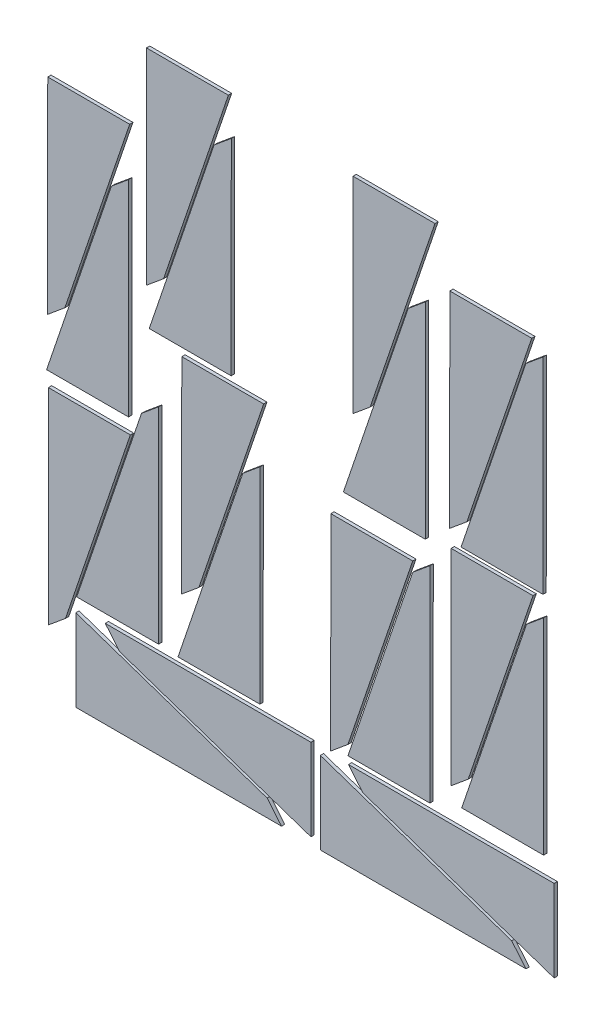
from build123d import *

# Parameters (mm, degrees)
BOSS_EXTRUDE1_DEPTH    = 0.5
BOSS_EXTRUDE1_2_DEPTH  = 0.5
BOSS_EXTRUDE1_3_DEPTH  = 0.5
BOSS_EXTRUDE1_4_DEPTH  = 0.5
BOSS_EXTRUDE1_5_DEPTH  = 0.5
BOSS_EXTRUDE1_6_DEPTH  = 0.5
BOSS_EXTRUDE1_7_DEPTH  = 0.5
BOSS_EXTRUDE1_8_DEPTH  = 0.5
BOSS_EXTRUDE1_9_DEPTH  = 0.5
BOSS_EXTRUDE1_10_DEPTH = 0.5
BOSS_EXTRUDE1_11_DEPTH = 0.5
BOSS_EXTRUDE1_12_DEPTH = 0.5
BOSS_EXTRUDE1_13_DEPTH = 0.5
BOSS_EXTRUDE1_14_DEPTH = 0.5
BOSS_EXTRUDE1_15_DEPTH = 0.5
BOSS_EXTRUDE1_16_DEPTH = 0.5
BOSS_EXTRUDE1_17_DEPTH = 0.5
BOSS_EXTRUDE1_18_DEPTH = 0.5
BOSS_EXTRUDE1_19_DEPTH = 0.5
BOSS_EXTRUDE1_20_DEPTH = 0.5


with BuildPart() as part:
    # Model → Boss-Extrude1 (new body)
    with BuildSketch(Plane.XY):
        Polygon((18.0727, 97.8343), (18.0727, 97.8187), (18.072691244, 97.803735595), (18.0543, 66.371), (20.664165109, 68.54157794), (20.6886, 68.5619), (20.698783041, 68.591962529), (30.6039, 97.834), (18.100296093, 97.83429954), (18.0811, 97.8343), align=None)
    extrude(amount=BOSS_EXTRUDE1_DEPTH)


with BuildPart() as body_2:
    # Model → Boss-Extrude1 2 (new body)
    with BuildSketch(Plane.XY):
        Polygon((31.0273, 60.8657), (31.0273, 60.8813), (31.027308756, 60.896264405), (31.0457, 92.329), (28.435834891, 90.15842206), (28.4114, 90.1381), (28.401216959, 90.108037471), (18.4961, 60.866), (30.999703907, 60.86570046), (31.0189, 60.8657), align=None)
    extrude(amount=BOSS_EXTRUDE1_2_DEPTH)


with BuildPart() as body_3:
    # Model → Boss-Extrude1 3 (new body)
    with BuildSketch(Plane.XY):
        Polygon((2.9727, 86.4343), (2.9727, 86.4187), (2.972691244, 86.403735595), (2.9543, 54.971), (5.564165109, 57.14157794), (5.5886, 57.1619), (5.598783041, 57.191962529), (15.5039, 86.434), (3.000296093, 86.43429954), (2.9811, 86.4343), align=None)
    extrude(amount=BOSS_EXTRUDE1_3_DEPTH)


with BuildPart() as body_4:
    # Model → Boss-Extrude1 4 (new body)
    with BuildSketch(Plane.XY):
        Polygon((15.3273, 47.5657), (15.3273, 47.5813), (15.327308756, 47.596264405), (15.3457, 79.029), (12.735834891, 76.85842206), (12.7114, 76.8381), (12.701216959, 76.808037471), (2.7961, 47.566), (15.299703907, 47.56570046), (15.3189, 47.5657), align=None)
    extrude(amount=BOSS_EXTRUDE1_4_DEPTH)


with BuildPart() as body_5:
    # Model → Boss-Extrude1 5 (new body)
    with BuildSketch(Plane.XY):
        Polygon((23.4727, 59.6343), (23.4727, 59.6187), (23.472691244, 59.603735595), (23.4543, 28.171), (26.064165109, 30.34157794), (26.0886, 30.3619), (26.098783041, 30.391962529), (36.0039, 59.634), (23.500296093, 59.63429954), (23.4811, 59.6343), align=None)
    extrude(amount=BOSS_EXTRUDE1_5_DEPTH)


with BuildPart() as body_6:
    # Model → Boss-Extrude1 6 (new body)
    with BuildSketch(Plane.XY):
        Polygon((35.4273, 19.5657), (35.4273, 19.5813), (35.427308756, 19.596264405), (35.4457, 51.029), (32.835834891, 48.85842206), (32.8114, 48.8381), (32.801216959, 48.808037471), (22.8961, 19.566), (35.399703907, 19.56570046), (35.4189, 19.5657), align=None)
    extrude(amount=BOSS_EXTRUDE1_6_DEPTH)


with BuildPart() as body_7:
    # Model → Boss-Extrude1 7 (new body)
    with BuildSketch(Plane.XY):
        Polygon((19.9273, 19.765388081), (19.9273, 19.7813), (19.927308756, 19.796264405), (19.9457, 51.229), (17.335834891, 49.05842206), (17.3114, 49.0381), (17.301216959, 49.008037471), (7.3961, 19.766), (19.899703907, 19.76570046), (19.9189, 19.7657), align=None)
    extrude(amount=BOSS_EXTRUDE1_7_DEPTH)


with BuildPart() as body_8:
    # Model → Boss-Extrude1 8 (new body)
    with BuildSketch(Plane.XY):
        Polygon((3.0727, 45.3343), (3.0727, 45.3187), (3.072691244, 45.303735595), (3.0543, 13.871), (5.664165109, 16.04157794), (5.6886, 16.0619), (5.698783041, 16.091962529), (15.6039, 45.334), (3.100296093, 45.33429954), (3.0811, 45.3343), align=None)
    extrude(amount=BOSS_EXTRUDE1_8_DEPTH)


with BuildPart() as body_9:
    # Model → Boss-Extrude1 9 (new body)
    with BuildSketch(Plane.XY):
        Polygon((43.2343, 18.4273), (43.2187, 18.4273), (43.203735595, 18.427308756), (11.771, 18.4457), (13.94157794, 15.835834891), (13.9619, 15.8114), (13.991962529, 15.801216959), (43.234, 5.8961), (43.23429954, 18.399703907), (43.2343, 18.4189), align=None)
    extrude(amount=BOSS_EXTRUDE1_9_DEPTH)


with BuildPart() as body_10:
    # Model → Boss-Extrude1 10 (new body)
    with BuildSketch(Plane.XY):
        Polygon((7.2657, 5.0727), (7.2813, 5.0727), (7.296264405, 5.072691244), (38.729, 5.0543), (36.55842206, 7.664165109), (36.5381, 7.6886), (36.508037471, 7.698783041), (7.266, 17.6039), (7.26570046, 5.100296093), (7.2657, 5.0811), align=None)
    extrude(amount=BOSS_EXTRUDE1_10_DEPTH)


with BuildPart() as body_11:
    # Model → Boss-Extrude1 11 (new body)
    with BuildSketch(Plane.XY):
        Polygon((49.6727, 96.6343), (49.6727, 96.6187), (49.672691244, 96.603735595), (49.6543, 65.171), (52.264165109, 67.34157794), (52.2886, 67.3619), (52.298783041, 67.391962529), (62.2039, 96.634), (49.700296093, 96.63429954), (49.6811, 96.6343), align=None)
    extrude(amount=BOSS_EXTRUDE1_11_DEPTH)


with BuildPart() as body_12:
    # Model → Boss-Extrude1 12 (new body)
    with BuildSketch(Plane.XY):
        Polygon((60.7273, 54.0657), (60.7273, 54.0813), (60.727308756, 54.096264405), (60.7457, 85.529), (58.135834891, 83.35842206), (58.1114, 83.3381), (58.101216959, 83.308037471), (48.1961, 54.066), (60.699703907, 54.06570046), (60.7189, 54.0657), align=None)
    extrude(amount=BOSS_EXTRUDE1_12_DEPTH)


with BuildPart() as body_13:
    # Model → Boss-Extrude1 13 (new body)
    with BuildSketch(Plane.XY):
        Polygon((64.4727, 88.8343), (64.4727, 88.8187), (64.472691244, 88.803735595), (64.4543, 57.371), (67.064165109, 59.54157794), (67.0886, 59.5619), (67.098783041, 59.591962529), (77.0039, 88.834), (64.500296093, 88.83429954), (64.4811, 88.8343), align=None)
    extrude(amount=BOSS_EXTRUDE1_13_DEPTH)


with BuildPart() as body_14:
    # Model → Boss-Extrude1 14 (new body)
    with BuildSketch(Plane.XY):
        Polygon((78.7273, 55.7657), (78.7273, 55.7813), (78.727308756, 55.796264405), (78.7457, 87.229), (76.135834891, 85.05842206), (76.1114, 85.0381), (76.101216959, 85.008037471), (66.1961, 55.766), (78.699703907, 55.76570046), (78.7189, 55.7657), align=None)
    extrude(amount=BOSS_EXTRUDE1_14_DEPTH)


with BuildPart() as body_15:
    # Model → Boss-Extrude1 15 (new body)
    with BuildSketch(Plane.XY):
        Polygon((64.6727, 54.8343), (64.6727, 54.8187), (64.672691244, 54.803735595), (64.6543, 23.371), (67.264165109, 25.54157794), (67.2886, 25.5619), (67.298783041, 25.591962529), (77.2039, 54.834), (64.700296093, 54.83429954), (64.6811, 54.8343), align=None)
    extrude(amount=BOSS_EXTRUDE1_15_DEPTH)


with BuildPart() as body_16:
    # Model → Boss-Extrude1 16 (new body)
    with BuildSketch(Plane.XY):
        Polygon((78.8273, 21.2657), (78.8273, 21.2813), (78.827308756, 21.296264405), (78.8457, 52.729), (76.235834891, 50.55842206), (76.2114, 50.5381), (76.201216959, 50.508037471), (66.2961, 21.266), (78.799703907, 21.26570046), (78.8189, 21.2657), align=None)
    extrude(amount=BOSS_EXTRUDE1_16_DEPTH)


with BuildPart() as body_17:
    # Model → Boss-Extrude1 17 (new body)
    with BuildSketch(Plane.XY):
        Polygon((61.4273, 19.4657), (61.4273, 19.4813), (61.427308756, 19.496264405), (61.4457, 50.929), (58.835834891, 48.75842206), (58.8114, 48.7381), (58.801216959, 48.708037471), (48.8961, 19.466), (61.399703907, 19.46570046), (61.4189, 19.4657), align=None)
    extrude(amount=BOSS_EXTRUDE1_17_DEPTH)


with BuildPart() as body_18:
    # Model → Boss-Extrude1 18 (new body)
    with BuildSketch(Plane.XY):
        Polygon((46.2727, 50.2343), (46.2727, 50.2187), (46.272691244, 50.203735595), (46.2543, 18.771), (48.864165109, 20.94157794), (48.8886, 20.9619), (48.898783041, 20.991962529), (58.8039, 50.234), (46.300296093, 50.23429954), (46.2811, 50.2343), align=None)
    extrude(amount=BOSS_EXTRUDE1_18_DEPTH)


with BuildPart() as body_19:
    # Model → Boss-Extrude1 19 (new body)
    with BuildSketch(Plane.XY):
        Polygon((80.4343, 18.3273), (80.4187, 18.3273), (80.403735595, 18.327308756), (48.971, 18.3457), (51.14157794, 15.735834891), (51.1619, 15.7114), (51.191962529, 15.701216959), (80.434, 5.7961), (80.43429954, 18.299703907), (80.4343, 18.3189), align=None)
    extrude(amount=BOSS_EXTRUDE1_19_DEPTH)


with BuildPart() as body_20:
    # Model → Boss-Extrude1 20 (new body)
    with BuildSketch(Plane.XY):
        Polygon((44.6657, 4.8727), (44.6813, 4.8727), (44.696264405, 4.872691244), (76.129, 4.8543), (73.95842206, 7.464165109), (73.9381, 7.4886), (73.908037471, 7.498783041), (44.666, 17.4039), (44.66570046, 4.900296093), (44.6657, 4.8811), align=None)
    extrude(amount=BOSS_EXTRUDE1_20_DEPTH)


solid = Compound([part.part, body_2.part, body_3.part, body_4.part, body_5.part, body_6.part, body_7.part, body_8.part, body_9.part, body_10.part, body_11.part, body_12.part, body_13.part, body_14.part, body_15.part, body_16.part, body_17.part, body_18.part, body_19.part, body_20.part])
